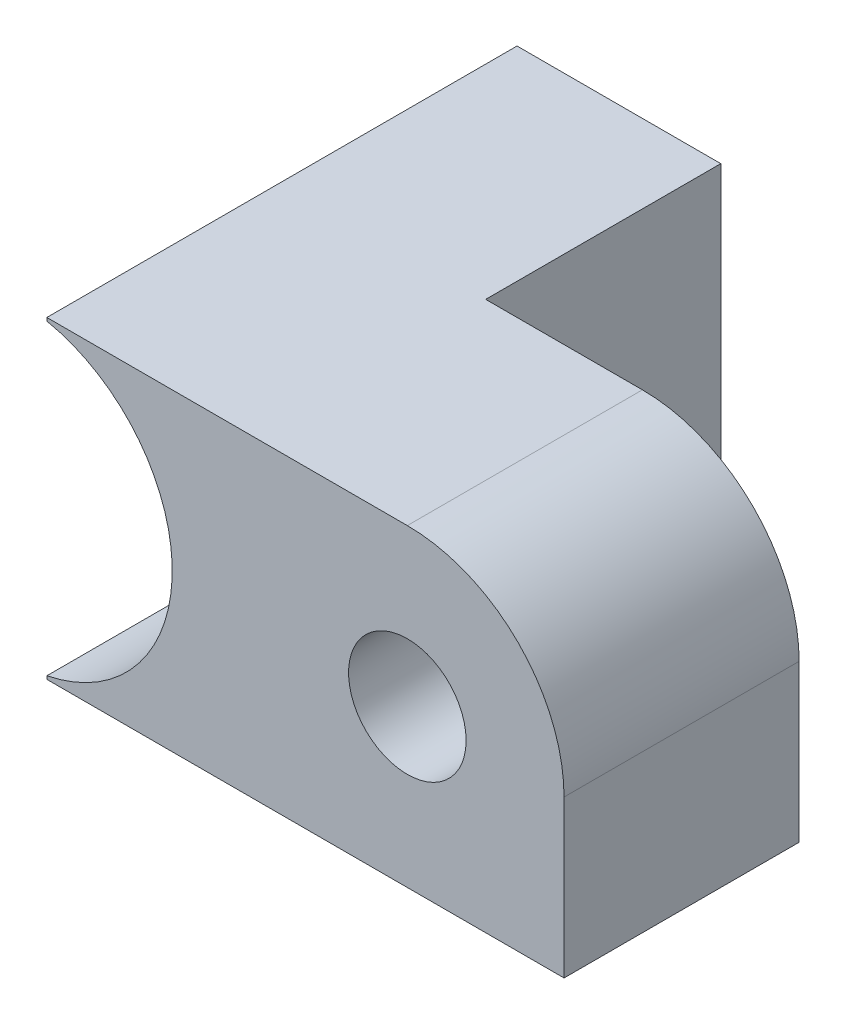
from build123d import *

# Parameters (mm, degrees)
BOSS_EXTRUDE1_DEPTH          = 38.1
CUT_EXTRUDE1_DEPTH           = 19.05
F_3_8_0_375_DIAMETER_HOLE1_D = 9.525
CHAMFER1_SIZE                = 1.27


with BuildPart() as part:
    # Sketch1 → Boss-Extrude1 (new body)
    with BuildSketch(Plane.XY):
        with BuildLine():
            Line((2.54, 0), (44.45, 0))
            Line((44.45, 0), (44.45, 12.7))
            ThreePointArc((44.45, 12.7), (40.730256121, 21.680256121), (31.75, 25.4))
            Line((31.75, 25.4), (2.54, 25.4))
            Line((2.54, 25.4), (2.54, 25.143407893))
            ThreePointArc((2.54, 25.143407893), (12.7, 12.7), (2.54, 0.256592107))
            Line((2.54, 0.256592107), (2.54, 0))
        make_face()
    extrude(amount=BOSS_EXTRUDE1_DEPTH)

    # Sketch2 → Cut-Extrude1 (cut)
    with BuildSketch(Plane(origin=(0, 0, 0), x_dir=(-1, 0, 0), z_dir=(0, 0, -1))):
        with BuildLine():
            Line((-19.05, 0), (-19.05, 25.4))
            Line((-19.05, 25.4), (-31.75, 25.4))
            ThreePointArc((-31.75, 25.4), (-40.730256121, 21.680256121), (-44.45, 12.7))
            Line((-44.45, 12.7), (-44.45, 0))
            Line((-44.45, 0), (-19.05, 0))
        make_face()
    extrude(amount=-CUT_EXTRUDE1_DEPTH, mode=Mode.SUBTRACT)

    # 3/8 (0.375) Diameter Hole1 (through all)
    with Locations(Plane.XY.offset(38.1)):
        with Locations((31.75, 12.7)):
            Hole(F_3_8_0_375_DIAMETER_HOLE1_D / 2)

    # Chamfer1
    chamfer1_edges = [part.edges().sort_by_distance(p)[0] for p in [
        (19.05, 0, 9.525),
    ]]
    chamfer(chamfer1_edges, length=CHAMFER1_SIZE)


solid = part.part
